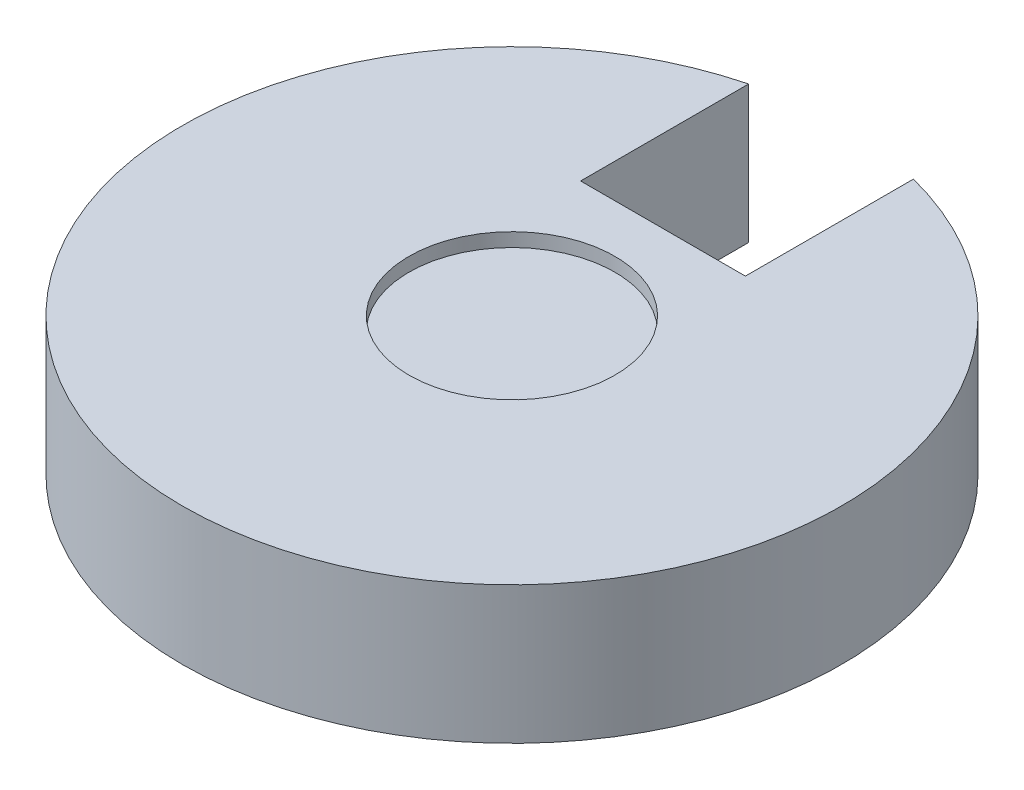
from build123d import *

# Parameters (mm, degrees)
BOSS_EXTRUDE1_DEPTH = 10
BOSS_EXTRUDE2_DEPTH = 9


with BuildPart() as part:
    # Sketch1 → Boss-Extrude1 (new body)
    with BuildSketch(Plane(origin=(0, 0, 0), x_dir=(1, 0, 0), z_dir=(0, 1, 0))):
        with BuildLine():
            Line((-6, 11), (-6, 23))
            Line((-6, 23), (-6, 23.237900077))
            ThreePointArc((-6, 23.237900077), (-23.80871271, -3.02410302), (0, -24))
            ThreePointArc((0, -24), (23.80871271, -3.02410302), (6, 23.237900077))
            Line((6, 23.237900077), (6, 23))
            Line((6, 23), (6, 11))
            Line((6, 11), (-6, 11))
        make_face()
        with BuildLine():
            ThreePointArc((7.5, 0), (5.303300859, -5.303300859), (0, -7.5))
            ThreePointArc((0, -7.5), (-5.303300859, 5.303300859), (7.5, 0))
        make_face(mode=Mode.SUBTRACT)
    extrude(amount=BOSS_EXTRUDE1_DEPTH)

    # Sketch1<3> → Boss-Extrude2 (add)
    with BuildSketch(Plane(origin=(0, 0, 0), x_dir=(1, 0, 0), z_dir=(0, 1, 0))):
        with BuildLine():
            ThreePointArc((7.5, 0), (-5.303300859, 5.303300859), (0, -7.5))
            ThreePointArc((0, -7.5), (5.303300859, -5.303300859), (7.5, 0))
        make_face()
    extrude(amount=BOSS_EXTRUDE2_DEPTH)


solid = part.part
